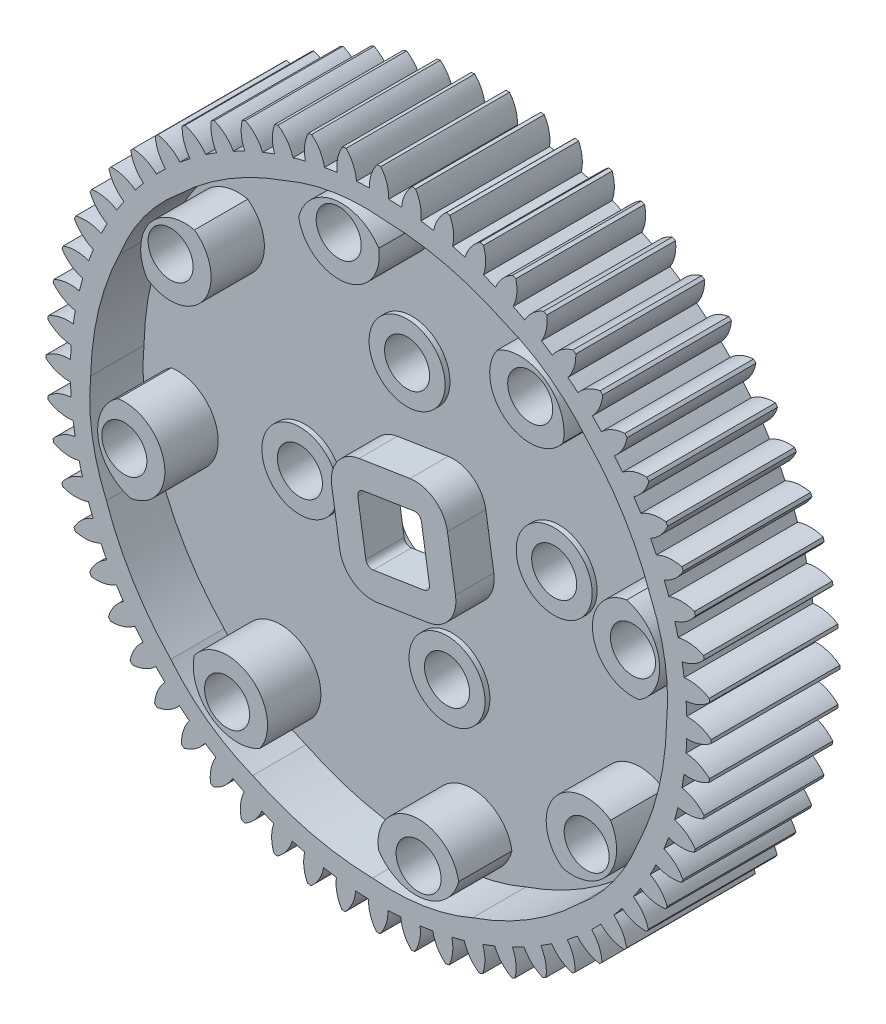
from build123d import *

# Parameters (mm, degrees)
EXTRUSION1_DEPTH = 12.7
EXTRUSION2_START = -5.2578
SKETCH2_R        = 3.75
EXTRUSION2_DEPTH = 2.1844
EXTRUSION3_DEPTH = 12.7
SKETCH4_R        = 2.2225
EXTRUSION4_DEPTH = 12.7
EXTRUSION5_START = -7.9248
SKETCH5_R        = 3.75
EXTRUSION5_DEPTH = 3.1496
EXTRUSION6_START = -7.9248
SKETCH6_R        = 2.2225
EXTRUSION6_DEPTH = 3.1496
EXTRUSION7_START = 3.78000006
EXTRUSION7_DEPTH = 3.78000006
EXTRUSION8_DEPTH = 5.2578


with BuildPart() as part:
    # Sketch1 → Extrusion1 (new body)
    with BuildSketch(Plane.XY):
        with BuildLine():
            ThreePointArc((-14.338556369, 26.825922305), (-15.129020546, 27.835404584), (-16.215598781, 28.516018884))
            ThreePointArc((-16.215598781, 28.516018884), (-16.364685345, 28.430723705), (-16.513323263, 28.344649083))
            ThreePointArc((-16.513323263, 28.344649083), (-16.470552427, 27.063220683), (-15.994676102, 25.872662071))
            ThreePointArc((-15.994676102, 25.872662071), (-16.533004358, 25.532020546), (-17.064080691, 25.180179833))
            ThreePointArc((-17.064080691, 25.180179833), (-17.955734254, 26.101506057), (-19.107503667, 26.664813527))
            ThreePointArc((-19.107503667, 26.664813527), (-19.246857745, 26.564401814), (-19.385684161, 26.463261825))
            ThreePointArc((-19.385684161, 26.463261825), (-19.209201887, 25.193323995), (-18.6114852, 24.059030008))
            ThreePointArc((-18.6114852, 24.059030008), (-19.111257702, 23.663983927), (-19.602647375, 23.258558041))
            ThreePointArc((-19.602647375, 23.258558041), (-20.58572118, 24.081633967), (-21.790062744, 24.521462893))
            ThreePointArc((-21.790062744, 24.521462893), (-21.918157544, 24.407034779), (-22.045651446, 24.291937533))
            ThreePointArc((-22.045651446, 24.291937533), (-21.737391311, 23.047403976), (-21.024382971, 21.981802177))
            ThreePointArc((-21.024382971, 21.981802177), (-21.480124107, 21.536679749), (-21.926443351, 21.082110621))
            ThreePointArc((-21.926443351, 21.082110621), (-22.990166637, 21.797918456), (-24.233885333, 22.109449981))
            ThreePointArc((-24.233885333, 22.109449981), (-24.349317422, 21.982259163), (-24.464081961, 21.85446569))
            ThreePointArc((-24.464081961, 21.85446569), (-24.027421327, 20.648971776), (-23.206933202, 19.663737122))
            ThreePointArc((-23.206933202, 19.663737122), (-23.613649778, 19.1734152), (-24.010008626, 18.674683184))
            ThreePointArc((-24.010008626, 18.674683184), (-25.142727017, 19.275380389), (-26.412196404, 19.455201308))
            ThreePointArc((-26.412196404, 19.455201308), (-26.513701083, 19.316641315), (-26.614478875, 19.177551748))
            ThreePointArc((-26.614478875, 19.177551748), (-26.054201886, 18.024305121), (-25.135223418, 17.130232047))
            ThreePointArc((-25.135223418, 17.130232047), (-25.48845936, 16.600082702), (-25.830515222, 16.062652011))
            ThreePointArc((-25.830515222, 16.062652011), (-27.019818419, 16.541657221), (-28.301129924, 16.587797378))
            ThreePointArc((-28.301129924, 16.587797378), (-28.387595086, 16.439386303), (-28.473281988, 16.290524535))
            ThreePointArc((-28.473281988, 16.290524535), (-27.795527158, 15.202160407), (-26.788126865, 14.409044566))
            ThreePointArc((-26.788126865, 14.409044566), (-27.084012048, 13.844876224), (-27.368017287, 13.274635061))
            ThreePointArc((-27.368017287, 13.274635061), (-28.600875036, 13.626700195), (-29.879990342, 13.538654068))
            ThreePointArc((-29.879990342, 13.538654068), (-29.950468657, 13.382017935), (-30.020125866, 13.225014927))
            ThreePointArc((-30.020125866, 13.225014927), (-29.232318818, 12.213457642), (-28.147533989, 11.529988577))
            ThreePointArc((-28.147533989, 11.529988577), (-28.382826632, 10.937982385), (-28.605669628, 10.341178432))
            ThreePointArc((-28.605669628, 10.341178432), (-29.868574481, 10.56244619), (-31.131479333, 10.341178432))
            ThreePointArc((-31.131479333, 10.341178432), (-31.185198626, 10.178033378), (-31.238062962, 10.014609288))
            ThreePointArc((-31.238062962, 10.014609288), (-30.348835075, 9.090941679), (-29.19855084, 8.524607621))
            ThreePointArc((-29.19855084, 8.524607621), (-29.370673027, 7.911249722), (-29.529912267, 7.294421687))
            ThreePointArc((-29.529912267, 7.294421687), (-30.809027573, 7.382467814), (-32.041885322, 7.03040268))
            ThreePointArc((-32.041885322, 7.03040268), (-32.078257034, 6.862536157), (-32.113749304, 6.694481493))
            ThreePointArc((-32.113749304, 6.694481493), (-31.132843144, 5.868823457), (-29.929662258, 5.425829279))
            ThreePointArc((-29.929662258, 5.425829279), (-30.036728183, 4.797839751), (-30.130619007, 4.167745732))
            ThreePointArc((-30.130619007, 4.167745732), (-31.411930512, 4.121605576), (-32.60123371, 3.642600366))
            ThreePointArc((-32.60123371, 3.642600366), (-32.619859344, 3.471851554), (-32.637590688, 3.301007559))
            ThreePointArc((-32.637590688, 3.301007559), (-31.575753269, 2.582405177), (-30.332858033, 2.267604417))
            ThreePointArc((-30.332858033, 2.267604417), (-30.37369466, 1.631863645), (-30.40120838, 0.995407083))
            ThreePointArc((-30.40120838, 0.995407083), (-31.670677767, 0.815586165), (-32.803396159, 0.21488896))
            ThreePointArc((-32.803396159, 0.21488896), (-32.804071649, 0.043128618), (-32.803847798, -0.128632906))
            ThreePointArc((-32.803847798, -0.128632906), (-31.672712834, -0.732306475), (-30.403720668, -0.915464794))
            ThreePointArc((-30.403720668, -0.915464794), (-30.377880582, -1.551991502), (-30.338715753, -2.187837455))
            ThreePointArc((-30.338715753, -2.187837455), (-31.582434449, -2.499368979), (-32.646157735, -3.215176815))
            ThreePointArc((-32.646157735, -3.215176815), (-32.62887568, -3.386066843), (-32.610699088, -3.556864041))
            ThreePointArc((-32.610699088, -3.556864041), (-31.422659528, -4.038994823), (-30.141473777, -4.088503981))
            ThreePointArc((-30.141473777, -4.088503981), (-30.049240087, -4.718842704), (-29.943825806, -5.347111587))
            ThreePointArc((-29.943825806, -5.347111587), (-31.14816737, -5.786940514), (-32.131241176, -6.610016439))
            ThreePointArc((-32.131241176, -6.610016439), (-32.096190921, -6.778163848), (-32.060260734, -6.946125429))
            ThreePointArc((-32.060260734, -6.946125429), (-30.82833299, -7.301431099), (-29.548990592, -7.216748663))
            ThreePointArc((-29.548990592, -7.216748663), (-29.391373829, -7.833993279), (-29.220865038, -8.447801646))
            ThreePointArc((-29.220865038, -8.447801646), (-30.372634451, -9.011109117), (-31.264288014, -9.932435341))
            ThreePointArc((-31.264288014, -9.932435341), (-31.211853579, -10.095997871), (-31.158563454, -10.259283614))
            ThreePointArc((-31.158563454, -10.259283614), (-29.896244784, -10.483871368), (-28.632762482, -10.265925136))
            ThreePointArc((-28.632762482, -10.265925136), (-28.411489529, -10.863312984), (-28.177754358, -11.455935823))
            ThreePointArc((-28.177754358, -11.455935823), (-29.264332593, -12.136550123), (-30.05479677, -13.146032402))
            ThreePointArc((-30.05479677, -13.146032402), (-29.985552636, -13.303218028), (-29.915486433, -13.46003894))
            ThreePointArc((-29.915486433, -13.46003894), (-28.636607063, -13.551448149), (-27.402827835, -13.202625986))
            ThreePointArc((-27.402827835, -13.202625986), (-27.120323005, -13.773611958), (-26.825922305, -14.338556369))
            ThreePointArc((-26.825922305, -14.338556369), (-27.835404584, -15.129020546), (-28.516018884, -16.215598781))
            ThreePointArc((-28.516018884, -16.215598781), (-28.430723705, -16.364685345), (-28.344649083, -16.513323263))
            ThreePointArc((-28.344649083, -16.513323263), (-27.063220683, -16.470552427), (-25.872662071, -15.994676102))
            ThreePointArc((-25.872662071, -15.994676102), (-25.532020546, -16.533004358), (-25.180179833, -17.064080691))
            ThreePointArc((-25.180179833, -17.064080691), (-26.101506057, -17.955734254), (-26.664813527, -19.107503667))
            ThreePointArc((-26.664813527, -19.107503667), (-26.564401814, -19.246857745), (-26.463261825, -19.385684161))
            ThreePointArc((-26.463261825, -19.385684161), (-25.193323995, -19.209201887), (-24.059030008, -18.6114852))
            ThreePointArc((-24.059030008, -18.6114852), (-23.663983927, -19.111257702), (-23.258558041, -19.602647375))
            ThreePointArc((-23.258558041, -19.602647375), (-24.081633967, -20.58572118), (-24.521462893, -21.790062744))
            ThreePointArc((-24.521462893, -21.790062744), (-24.407034779, -21.918157544), (-24.291937533, -22.045651446))
            ThreePointArc((-24.291937533, -22.045651446), (-23.047403976, -21.737391311), (-21.981802177, -21.024382971))
            ThreePointArc((-21.981802177, -21.024382971), (-21.536679749, -21.480124107), (-21.082110621, -21.926443351))
            ThreePointArc((-21.082110621, -21.926443351), (-21.797918456, -22.990166637), (-22.109449981, -24.233885333))
            ThreePointArc((-22.109449981, -24.233885333), (-21.982259163, -24.349317422), (-21.85446569, -24.464081961))
            ThreePointArc((-21.85446569, -24.464081961), (-20.648971776, -24.027421327), (-19.663737122, -23.206933202))
            ThreePointArc((-19.663737122, -23.206933202), (-19.1734152, -23.613649778), (-18.674683184, -24.010008626))
            ThreePointArc((-18.674683184, -24.010008626), (-19.275380389, -25.142727017), (-19.455201308, -26.412196404))
            ThreePointArc((-19.455201308, -26.412196404), (-19.316641315, -26.513701083), (-19.177551748, -26.614478875))
            ThreePointArc((-19.177551748, -26.614478875), (-18.024305121, -26.054201886), (-17.130232047, -25.135223418))
            ThreePointArc((-17.130232047, -25.135223418), (-16.600082702, -25.48845936), (-16.062652011, -25.830515222))
            ThreePointArc((-16.062652011, -25.830515222), (-16.541657221, -27.019818419), (-16.587797378, -28.301129924))
            ThreePointArc((-16.587797378, -28.301129924), (-16.439386303, -28.387595086), (-16.290524535, -28.473281988))
            ThreePointArc((-16.290524535, -28.473281988), (-15.202160407, -27.795527158), (-14.409044566, -26.788126865))
            ThreePointArc((-14.409044566, -26.788126865), (-13.844876224, -27.084012048), (-13.274635061, -27.368017287))
            ThreePointArc((-13.274635061, -27.368017287), (-13.626700195, -28.600875036), (-13.538654068, -29.879990342))
            ThreePointArc((-13.538654068, -29.879990342), (-13.382017935, -29.950468657), (-13.225014927, -30.020125866))
            ThreePointArc((-13.225014927, -30.020125866), (-12.213457642, -29.232318818), (-11.529988577, -28.147533989))
            ThreePointArc((-11.529988577, -28.147533989), (-10.937982385, -28.382826632), (-10.341178432, -28.605669628))
            ThreePointArc((-10.341178432, -28.605669628), (-10.56244619, -29.868574481), (-10.341178432, -31.131479333))
            ThreePointArc((-10.341178432, -31.131479333), (-10.178033378, -31.185198626), (-10.014609288, -31.238062962))
            ThreePointArc((-10.014609288, -31.238062962), (-9.090941679, -30.348835075), (-8.524607621, -29.19855084))
            ThreePointArc((-8.524607621, -29.19855084), (-7.911249722, -29.370673027), (-7.294421687, -29.529912267))
            ThreePointArc((-7.294421687, -29.529912267), (-7.382467814, -30.809027573), (-7.03040268, -32.041885322))
            ThreePointArc((-7.03040268, -32.041885322), (-6.862536157, -32.078257034), (-6.694481493, -32.113749304))
            ThreePointArc((-6.694481493, -32.113749304), (-5.868823457, -31.132843144), (-5.425829279, -29.929662258))
            ThreePointArc((-5.425829279, -29.929662258), (-4.797839751, -30.036728183), (-4.167745732, -30.130619007))
            ThreePointArc((-4.167745732, -30.130619007), (-4.121605576, -31.411930512), (-3.642600366, -32.60123371))
            ThreePointArc((-3.642600366, -32.60123371), (-3.471851554, -32.619859344), (-3.301007559, -32.637590688))
            ThreePointArc((-3.301007559, -32.637590688), (-2.582405177, -31.575753269), (-2.267604417, -30.332858033))
            ThreePointArc((-2.267604417, -30.332858033), (-1.631863645, -30.37369466), (-0.995407083, -30.40120838))
            ThreePointArc((-0.995407083, -30.40120838), (-0.815586165, -31.670677767), (-0.21488896, -32.803396159))
            ThreePointArc((-0.21488896, -32.803396159), (-0.043128618, -32.804071649), (0.128632906, -32.803847798))
            ThreePointArc((0.128632906, -32.803847798), (0.732306475, -31.672712834), (0.915464794, -30.403720668))
            ThreePointArc((0.915464794, -30.403720668), (1.551991502, -30.377880582), (2.187837455, -30.338715753))
            ThreePointArc((2.187837455, -30.338715753), (2.499368979, -31.582434449), (3.215176815, -32.646157735))
            ThreePointArc((3.215176815, -32.646157735), (3.386066843, -32.62887568), (3.556864041, -32.610699088))
            ThreePointArc((3.556864041, -32.610699088), (4.038994823, -31.422659528), (4.088503981, -30.141473777))
            ThreePointArc((4.088503981, -30.141473777), (4.718842704, -30.049240087), (5.347111587, -29.943825806))
            ThreePointArc((5.347111587, -29.943825806), (5.786940514, -31.14816737), (6.610016439, -32.131241176))
            ThreePointArc((6.610016439, -32.131241176), (6.778163848, -32.096190921), (6.946125429, -32.060260734))
            ThreePointArc((6.946125429, -32.060260734), (7.301431099, -30.82833299), (7.216748663, -29.548990592))
            ThreePointArc((7.216748663, -29.548990592), (7.833993279, -29.391373829), (8.447801646, -29.220865038))
            ThreePointArc((8.447801646, -29.220865038), (9.011109117, -30.372634451), (9.932435341, -31.264288014))
            ThreePointArc((9.932435341, -31.264288014), (10.095997871, -31.211853579), (10.259283614, -31.158563454))
            ThreePointArc((10.259283614, -31.158563454), (10.483871368, -29.896244784), (10.265925136, -28.632762482))
            ThreePointArc((10.265925136, -28.632762482), (10.863312984, -28.411489529), (11.455935823, -28.177754358))
            ThreePointArc((11.455935823, -28.177754358), (12.136550123, -29.264332593), (13.146032402, -30.05479677))
            ThreePointArc((13.146032402, -30.05479677), (13.303218028, -29.985552636), (13.46003894, -29.915486433))
            ThreePointArc((13.46003894, -29.915486433), (13.551448149, -28.636607063), (13.202625986, -27.402827835))
            ThreePointArc((13.202625986, -27.402827835), (13.773611958, -27.120323005), (14.338556369, -26.825922305))
            ThreePointArc((14.338556369, -26.825922305), (15.129020546, -27.835404584), (16.215598781, -28.516018884))
            ThreePointArc((16.215598781, -28.516018884), (16.364685345, -28.430723705), (16.513323263, -28.344649083))
            ThreePointArc((16.513323263, -28.344649083), (16.470552427, -27.063220683), (15.994676102, -25.872662071))
            ThreePointArc((15.994676102, -25.872662071), (16.533004358, -25.532020546), (17.064080691, -25.180179833))
            ThreePointArc((17.064080691, -25.180179833), (17.955734254, -26.101506057), (19.107503667, -26.664813527))
            ThreePointArc((19.107503667, -26.664813527), (19.246857745, -26.564401814), (19.385684161, -26.463261825))
            ThreePointArc((19.385684161, -26.463261825), (19.209201887, -25.193323995), (18.6114852, -24.059030008))
            ThreePointArc((18.6114852, -24.059030008), (19.111257702, -23.663983927), (19.602647375, -23.258558041))
            ThreePointArc((19.602647375, -23.258558041), (20.58572118, -24.081633967), (21.790062744, -24.521462893))
            ThreePointArc((21.790062744, -24.521462893), (21.918157544, -24.407034779), (22.045651446, -24.291937533))
            ThreePointArc((22.045651446, -24.291937533), (21.737391311, -23.047403976), (21.024382971, -21.981802177))
            ThreePointArc((21.024382971, -21.981802177), (21.480124107, -21.536679749), (21.926443351, -21.082110621))
            ThreePointArc((21.926443351, -21.082110621), (22.990166637, -21.797918456), (24.233885333, -22.109449981))
            ThreePointArc((24.233885333, -22.109449981), (24.349317422, -21.982259163), (24.464081961, -21.85446569))
            ThreePointArc((24.464081961, -21.85446569), (24.027421327, -20.648971776), (23.206933202, -19.663737122))
            ThreePointArc((23.206933202, -19.663737122), (23.613649778, -19.1734152), (24.010008626, -18.674683184))
            ThreePointArc((24.010008626, -18.674683184), (25.142727017, -19.275380389), (26.412196404, -19.455201308))
            ThreePointArc((26.412196404, -19.455201308), (26.513701083, -19.316641315), (26.614478875, -19.177551748))
            ThreePointArc((26.614478875, -19.177551748), (26.054201886, -18.024305121), (25.135223418, -17.130232047))
            ThreePointArc((25.135223418, -17.130232047), (25.48845936, -16.600082702), (25.830515222, -16.062652011))
            ThreePointArc((25.830515222, -16.062652011), (27.019818419, -16.541657221), (28.301129924, -16.587797378))
            ThreePointArc((28.301129924, -16.587797378), (28.387595086, -16.439386303), (28.473281988, -16.290524535))
            ThreePointArc((28.473281988, -16.290524535), (27.795527158, -15.202160407), (26.788126865, -14.409044566))
            ThreePointArc((26.788126865, -14.409044566), (27.084012048, -13.844876224), (27.368017287, -13.274635061))
            ThreePointArc((27.368017287, -13.274635061), (28.600875036, -13.626700195), (29.879990342, -13.538654068))
            ThreePointArc((29.879990342, -13.538654068), (29.950468657, -13.382017935), (30.020125866, -13.225014927))
            ThreePointArc((30.020125866, -13.225014927), (29.232318818, -12.213457642), (28.147533989, -11.529988577))
            ThreePointArc((28.147533989, -11.529988577), (28.382826632, -10.937982385), (28.605669628, -10.341178432))
            ThreePointArc((28.605669628, -10.341178432), (29.868574481, -10.56244619), (31.131479333, -10.341178432))
            ThreePointArc((31.131479333, -10.341178432), (31.185198626, -10.178033378), (31.238062962, -10.014609288))
            ThreePointArc((31.238062962, -10.014609288), (30.348835075, -9.090941679), (29.19855084, -8.524607621))
            ThreePointArc((29.19855084, -8.524607621), (29.370673027, -7.911249722), (29.529912267, -7.294421687))
            ThreePointArc((29.529912267, -7.294421687), (30.809027573, -7.382467814), (32.041885322, -7.03040268))
            ThreePointArc((32.041885322, -7.03040268), (32.078257033, -6.862536157), (32.113749304, -6.694481493))
            ThreePointArc((32.113749304, -6.694481493), (31.132843144, -5.868823457), (29.929662258, -5.425829279))
            ThreePointArc((29.929662258, -5.425829279), (30.036728183, -4.797839751), (30.130619007, -4.167745732))
            ThreePointArc((30.130619007, -4.167745732), (31.411930512, -4.121605576), (32.60123371, -3.642600366))
            ThreePointArc((32.60123371, -3.642600366), (32.619859344, -3.471851554), (32.637590688, -3.301007559))
            ThreePointArc((32.637590688, -3.301007559), (31.575753269, -2.582405177), (30.332858033, -2.267604417))
            ThreePointArc((30.332858033, -2.267604417), (30.37369466, -1.631863645), (30.40120838, -0.995407083))
            ThreePointArc((30.40120838, -0.995407083), (31.670677767, -0.815586165), (32.803396159, -0.21488896))
            ThreePointArc((32.803396159, -0.21488896), (32.804071649, -0.043128618), (32.803847798, 0.128632906))
            ThreePointArc((32.803847798, 0.128632906), (31.672712834, 0.732306475), (30.403720668, 0.915464794))
            ThreePointArc((30.403720668, 0.915464794), (30.377880582, 1.551991502), (30.338715753, 2.187837455))
            ThreePointArc((30.338715753, 2.187837455), (31.582434449, 2.499368979), (32.646157735, 3.215176815))
            ThreePointArc((32.646157735, 3.215176815), (32.62887568, 3.386066843), (32.610699088, 3.556864041))
            ThreePointArc((32.610699088, 3.556864041), (31.422659528, 4.038994823), (30.141473777, 4.088503981))
            ThreePointArc((30.141473777, 4.088503981), (30.049240087, 4.718842704), (29.943825806, 5.347111587))
            ThreePointArc((29.943825806, 5.347111587), (31.14816737, 5.786940514), (32.131241176, 6.610016439))
            ThreePointArc((32.131241176, 6.610016439), (32.096190921, 6.778163848), (32.060260734, 6.946125429))
            ThreePointArc((32.060260734, 6.946125429), (30.82833299, 7.301431099), (29.548990592, 7.216748663))
            ThreePointArc((29.548990592, 7.216748663), (29.391373829, 7.833993279), (29.220865038, 8.447801646))
            ThreePointArc((29.220865038, 8.447801646), (30.372634451, 9.011109117), (31.264288014, 9.932435341))
            ThreePointArc((31.264288014, 9.932435341), (31.211853579, 10.095997871), (31.158563454, 10.259283614))
            ThreePointArc((31.158563454, 10.259283614), (29.896244784, 10.483871368), (28.632762482, 10.265925136))
            ThreePointArc((28.632762482, 10.265925136), (28.411489529, 10.863312984), (28.177754358, 11.455935823))
            ThreePointArc((28.177754358, 11.455935823), (29.264332593, 12.136550123), (30.05479677, 13.146032402))
            ThreePointArc((30.05479677, 13.146032402), (29.985552636, 13.303218028), (29.915486433, 13.46003894))
            ThreePointArc((29.915486433, 13.46003894), (28.636607063, 13.551448149), (27.402827835, 13.202625986))
            ThreePointArc((27.402827835, 13.202625986), (27.120323005, 13.773611958), (26.825922305, 14.338556369))
            ThreePointArc((26.825922305, 14.338556369), (27.835404584, 15.129020546), (28.516018884, 16.215598781))
            ThreePointArc((28.516018884, 16.215598781), (28.430723705, 16.364685345), (28.344649083, 16.513323263))
            ThreePointArc((28.344649083, 16.513323263), (27.063220683, 16.470552427), (25.872662071, 15.994676102))
            ThreePointArc((25.872662071, 15.994676102), (25.532020546, 16.533004358), (25.180179833, 17.064080691))
            ThreePointArc((25.180179833, 17.064080691), (26.101506057, 17.955734254), (26.664813527, 19.107503667))
            ThreePointArc((26.664813527, 19.107503667), (26.564401814, 19.246857745), (26.463261825, 19.385684161))
            ThreePointArc((26.463261825, 19.385684161), (25.193323995, 19.209201887), (24.059030008, 18.6114852))
            ThreePointArc((24.059030008, 18.6114852), (23.663983927, 19.111257702), (23.258558041, 19.602647375))
            ThreePointArc((23.258558041, 19.602647375), (24.081633967, 20.58572118), (24.521462893, 21.790062744))
            ThreePointArc((24.521462893, 21.790062744), (24.407034779, 21.918157544), (24.291937533, 22.045651446))
            ThreePointArc((24.291937533, 22.045651446), (23.047403976, 21.737391311), (21.981802177, 21.024382971))
            ThreePointArc((21.981802177, 21.024382971), (21.536679749, 21.480124107), (21.082110621, 21.926443351))
            ThreePointArc((21.082110621, 21.926443351), (21.797918456, 22.990166637), (22.109449981, 24.233885333))
            ThreePointArc((22.109449981, 24.233885333), (21.982259163, 24.349317422), (21.85446569, 24.464081961))
            ThreePointArc((21.85446569, 24.464081961), (20.648971776, 24.027421327), (19.663737122, 23.206933202))
            ThreePointArc((19.663737122, 23.206933202), (19.1734152, 23.613649778), (18.674683184, 24.010008626))
            ThreePointArc((18.674683184, 24.010008626), (19.275380389, 25.142727017), (19.455201308, 26.412196404))
            ThreePointArc((19.455201308, 26.412196404), (19.316641315, 26.513701083), (19.177551748, 26.614478875))
            ThreePointArc((19.177551748, 26.614478875), (18.024305121, 26.054201886), (17.130232047, 25.135223418))
            ThreePointArc((17.130232047, 25.135223418), (16.600082702, 25.48845936), (16.062652011, 25.830515222))
            ThreePointArc((16.062652011, 25.830515222), (16.541657221, 27.019818419), (16.587797378, 28.301129924))
            ThreePointArc((16.587797378, 28.301129924), (16.439386303, 28.387595086), (16.290524535, 28.473281988))
            ThreePointArc((16.290524535, 28.473281988), (15.202160407, 27.795527158), (14.409044566, 26.788126865))
            ThreePointArc((14.409044566, 26.788126865), (13.844876224, 27.084012048), (13.274635061, 27.368017287))
            ThreePointArc((13.274635061, 27.368017287), (13.626700195, 28.600875036), (13.538654068, 29.879990342))
            ThreePointArc((13.538654068, 29.879990342), (13.382017935, 29.950468657), (13.225014927, 30.020125866))
            ThreePointArc((13.225014927, 30.020125866), (12.213457642, 29.232318818), (11.529988577, 28.147533989))
            ThreePointArc((11.529988577, 28.147533989), (10.937982385, 28.382826632), (10.341178432, 28.605669628))
            ThreePointArc((10.341178432, 28.605669628), (10.56244619, 29.868574481), (10.341178432, 31.131479333))
            ThreePointArc((10.341178432, 31.131479333), (10.178033378, 31.185198626), (10.014609288, 31.238062962))
            ThreePointArc((10.014609288, 31.238062962), (9.090941679, 30.348835075), (8.524607621, 29.19855084))
            ThreePointArc((8.524607621, 29.19855084), (7.911249722, 29.370673027), (7.294421687, 29.529912267))
            ThreePointArc((7.294421687, 29.529912267), (7.382467814, 30.809027573), (7.03040268, 32.041885322))
            ThreePointArc((7.03040268, 32.041885322), (6.862536157, 32.078257033), (6.694481493, 32.113749304))
            ThreePointArc((6.694481493, 32.113749304), (5.868823457, 31.132843144), (5.425829279, 29.929662258))
            ThreePointArc((5.425829279, 29.929662258), (4.797839751, 30.036728183), (4.167745732, 30.130619007))
            ThreePointArc((4.167745732, 30.130619007), (4.121605576, 31.411930512), (3.642600366, 32.60123371))
            ThreePointArc((3.642600366, 32.60123371), (3.471851554, 32.619859344), (3.301007559, 32.637590688))
            ThreePointArc((3.301007559, 32.637590688), (2.582405177, 31.575753269), (2.267604417, 30.332858033))
            ThreePointArc((2.267604417, 30.332858033), (1.631863645, 30.37369466), (0.995407083, 30.40120838))
            ThreePointArc((0.995407083, 30.40120838), (0.815586165, 31.670677767), (0.21488896, 32.803396159))
            ThreePointArc((0.21488896, 32.803396159), (0.043128618, 32.804071649), (-0.128632906, 32.803847798))
            ThreePointArc((-0.128632906, 32.803847798), (-0.732306475, 31.672712834), (-0.915464794, 30.403720668))
            ThreePointArc((-0.915464794, 30.403720668), (-1.551991502, 30.377880582), (-2.187837455, 30.338715753))
            ThreePointArc((-2.187837455, 30.338715753), (-2.499368979, 31.582434449), (-3.215176815, 32.646157735))
            ThreePointArc((-3.215176815, 32.646157735), (-3.386066843, 32.62887568), (-3.556864041, 32.610699088))
            ThreePointArc((-3.556864041, 32.610699088), (-4.038994823, 31.422659528), (-4.088503981, 30.141473777))
            ThreePointArc((-4.088503981, 30.141473777), (-4.718842704, 30.049240087), (-5.347111587, 29.943825806))
            ThreePointArc((-5.347111587, 29.943825806), (-5.786940514, 31.14816737), (-6.610016439, 32.131241176))
            ThreePointArc((-6.610016439, 32.131241176), (-6.778163848, 32.096190921), (-6.946125429, 32.060260734))
            ThreePointArc((-6.946125429, 32.060260734), (-7.301431099, 30.82833299), (-7.216748663, 29.548990592))
            ThreePointArc((-7.216748663, 29.548990592), (-7.833993279, 29.391373829), (-8.447801646, 29.220865038))
            ThreePointArc((-8.447801646, 29.220865038), (-9.011109117, 30.372634451), (-9.932435341, 31.264288014))
            ThreePointArc((-9.932435341, 31.264288014), (-10.095997871, 31.211853579), (-10.259283614, 31.158563454))
            ThreePointArc((-10.259283614, 31.158563454), (-10.483871368, 29.896244784), (-10.265925136, 28.632762482))
            ThreePointArc((-10.265925136, 28.632762482), (-10.863312984, 28.411489529), (-11.455935823, 28.177754358))
            ThreePointArc((-11.455935823, 28.177754358), (-12.136550123, 29.264332593), (-13.146032402, 30.05479677))
            ThreePointArc((-13.146032402, 30.05479677), (-13.303218028, 29.985552636), (-13.46003894, 29.915486433))
            ThreePointArc((-13.46003894, 29.915486433), (-13.551448149, 28.636607063), (-13.202625986, 27.402827835))
            ThreePointArc((-13.202625986, 27.402827835), (-13.773611958, 27.120323005), (-14.338556369, 26.825922305))
        make_face()
        with BuildLine():
            ThreePointArc((-9.279260902, 26.859814284), (-14.816234287, 24.249402215), (-19.665701273, 20.513763664))
            ThreePointArc((-19.665701273, 20.513763664), (-23.129908784, 16.851368666), (-25.554185132, 12.431328509))
            ThreePointArc((-25.554185132, 12.431328509), (-27.623576483, 6.670257005), (-28.411172122, 0.599670662))
            ThreePointArc((-28.411172122, 0.599670662), (-28.271032405, -4.439598293), (-26.859814284, -9.279260902))
            ThreePointArc((-26.859814284, -9.279260902), (-24.249402215, -14.816234287), (-20.513763664, -19.665701273))
            ThreePointArc((-20.513763664, -19.665701273), (-16.851368666, -23.129908784), (-12.431328509, -25.554185132))
            ThreePointArc((-12.431328509, -25.554185132), (-6.670257005, -27.623576483), (-0.599670662, -28.411172122))
            ThreePointArc((-0.599670662, -28.411172122), (4.439598293, -28.271032405), (9.279260902, -26.859814284))
            ThreePointArc((9.279260902, -26.859814284), (14.816234287, -24.249402215), (19.665701273, -20.513763664))
            ThreePointArc((19.665701273, -20.513763664), (23.129908784, -16.851368666), (25.554185132, -12.431328509))
            ThreePointArc((25.554185132, -12.431328509), (27.623576483, -6.670257005), (28.411172122, -0.599670662))
            ThreePointArc((28.411172122, -0.599670662), (28.271032405, 4.439598293), (26.859814284, 9.279260902))
            ThreePointArc((26.859814284, 9.279260902), (24.249402215, 14.816234287), (20.513763664, 19.665701273))
            ThreePointArc((20.513763664, 19.665701273), (16.851368666, 23.129908784), (12.431328509, 25.554185132))
            ThreePointArc((12.431328509, 25.554185132), (6.670257005, 27.623576483), (0.599670662, 28.411172122))
            ThreePointArc((0.599670662, 28.411172122), (-4.439598293, 28.271032405), (-9.279260902, 26.859814284))
        make_face(mode=Mode.SUBTRACT)
    extrude(amount=-EXTRUSION1_DEPTH)

    # Sketch2 → Extrusion2 (add)
    with BuildSketch(Plane.XY.offset(EXTRUSION2_START)):
        with BuildLine():
            ThreePointArc((-9.279260902, 26.859814284), (-14.816234287, 24.249402215), (-19.665701273, 20.513763664))
            ThreePointArc((-19.665701273, 20.513763664), (-23.129908784, 16.851368666), (-25.554185132, 12.431328509))
            ThreePointArc((-25.554185132, 12.431328509), (-27.623576483, 6.670257005), (-28.411172122, 0.599670662))
            ThreePointArc((-28.411172122, 0.599670662), (-28.271032405, -4.439598293), (-26.859814284, -9.279260902))
            ThreePointArc((-26.859814284, -9.279260902), (-24.249402215, -14.816234287), (-20.513763664, -19.665701273))
            ThreePointArc((-20.513763664, -19.665701273), (-16.851368666, -23.129908784), (-12.431328509, -25.554185132))
            ThreePointArc((-12.431328509, -25.554185132), (-6.670257005, -27.623576483), (-0.599670662, -28.411172122))
            ThreePointArc((-0.599670662, -28.411172122), (4.439598293, -28.271032405), (9.279260902, -26.859814284))
            ThreePointArc((9.279260902, -26.859814284), (14.816234287, -24.249402215), (19.665701273, -20.513763664))
            ThreePointArc((19.665701273, -20.513763664), (23.129908784, -16.851368666), (25.554185132, -12.431328509))
            ThreePointArc((25.554185132, -12.431328509), (27.623576483, -6.670257005), (28.411172122, -0.599670662))
            ThreePointArc((28.411172122, -0.599670662), (28.271032405, 4.439598293), (26.859814284, 9.279260902))
            ThreePointArc((26.859814284, 9.279260902), (24.249402215, 14.816234287), (20.513763664, 19.665701273))
            ThreePointArc((20.513763664, 19.665701273), (16.851368666, 23.129908784), (12.431328509, 25.554185132))
            ThreePointArc((12.431328509, 25.554185132), (6.670257005, 27.623576483), (0.599670662, 28.411172122))
            ThreePointArc((0.599670662, 28.411172122), (-4.439598293, 28.271032405), (-9.279260902, 26.859814284))
        make_face()
        with Locations((-1.970224455, 12.546243087)):
            Circle(SKETCH2_R, mode=Mode.SUBTRACT)
        with Locations((-12.546243087, -1.970224455)):
            Circle(SKETCH2_R, mode=Mode.SUBTRACT)
        with Locations((12.546243087, 1.970224455)):
            Circle(SKETCH2_R, mode=Mode.SUBTRACT)
        with Locations((1.970224455, -12.546243087)):
            Circle(SKETCH2_R, mode=Mode.SUBTRACT)
        with BuildLine():
            Line((5.315977553, 3.405933448), (6.104067335, -1.612563787))
            ThreePointArc((6.104067335, -1.612563787), (5.522002496, -4.023072495), (3.405933448, -5.315977553))
            Line((3.405933448, -5.315977553), (-1.612563787, -6.104067335))
            ThreePointArc((-1.612563787, -6.104067335), (-4.023072495, -5.522002496), (-5.315977553, -3.405933448))
            Line((-5.315977553, -3.405933448), (-6.104067335, 1.612563787))
            ThreePointArc((-6.104067335, 1.612563787), (-5.522002496, 4.023072495), (-3.405933448, 5.315977553))
            Line((-3.405933448, 5.315977553), (1.612563787, 6.104067335))
            ThreePointArc((1.612563787, 6.104067335), (4.023072495, 5.522002496), (5.315977553, 3.405933448))
        make_face(mode=Mode.SUBTRACT)
        with BuildLine():
            ThreePointArc((-25.713029309, 0.011123717), (-27.678296511, -4.346516823), (-24.471943039, -7.892021535))
            ThreePointArc((-24.471943039, -7.892021535), (-21.140913548, -3.319905774), (-25.713029309, 0.011123717))
        make_face(mode=Mode.SUBTRACT)
        with BuildLine():
            ThreePointArc((18.189723045, 18.173991734), (16.498059634, 22.644962675), (11.723774927, 22.884778816))
            ThreePointArc((11.723774927, 22.884778816), (12.601355445, 17.296411216), (18.189723045, 18.173991734))
        make_face(mode=Mode.SUBTRACT)
        with BuildLine():
            ThreePointArc((-0.011123717, -25.713029309), (4.346516823, -27.678296511), (7.892021535, -24.471943039))
            ThreePointArc((7.892021535, -24.471943039), (3.319905774, -21.140913548), (-0.011123717, -25.713029309))
        make_face(mode=Mode.SUBTRACT)
        with BuildLine():
            ThreePointArc((-7.892021535, 24.471943039), (-3.319905774, 21.140913548), (0.011123717, 25.713029309))
            ThreePointArc((0.011123717, 25.713029309), (-4.346516823, 27.678296511), (-7.892021535, 24.471943039))
        make_face(mode=Mode.SUBTRACT)
        with BuildLine():
            ThreePointArc((-11.723774927, -22.884778816), (-12.601355445, -17.296411216), (-18.189723045, -18.173991734))
            ThreePointArc((-18.189723045, -18.173991734), (-16.498059634, -22.644962675), (-11.723774927, -22.884778816))
        make_face(mode=Mode.SUBTRACT)
        with BuildLine():
            ThreePointArc((-18.173991734, 18.189723045), (-22.644962675, 16.498059634), (-22.884778816, 11.723774927))
            ThreePointArc((-22.884778816, 11.723774927), (-17.296411216, 12.601355445), (-18.173991734, 18.189723045))
        make_face(mode=Mode.SUBTRACT)
        with BuildLine():
            ThreePointArc((22.884778816, -11.723774927), (17.296411216, -12.601355445), (18.173991734, -18.189723045))
            ThreePointArc((18.173991734, -18.189723045), (22.644962675, -16.498059634), (22.884778816, -11.723774927))
        make_face(mode=Mode.SUBTRACT)
        with BuildLine():
            ThreePointArc((25.713029309, -0.011123717), (27.678296511, 4.346516823), (24.471943039, 7.892021535))
            ThreePointArc((24.471943039, 7.892021535), (21.140913548, 3.319905774), (25.713029309, -0.011123717))
        make_face(mode=Mode.SUBTRACT)
    extrude(amount=-EXTRUSION2_DEPTH)

    # Sketch3 → Extrusion3 (add)
    with BuildSketch(Plane.XY):
        with BuildLine():
            ThreePointArc((-25.713029309, 0.011123717), (-27.678296511, -4.346516823), (-24.471943039, -7.892021535))
            ThreePointArc((-24.471943039, -7.892021535), (-21.140913548, -3.319905774), (-25.713029309, 0.011123717))
        make_face()
        with BuildLine():
            ThreePointArc((18.189723045, 18.173991734), (16.498059634, 22.644962675), (11.723774927, 22.884778816))
            ThreePointArc((11.723774927, 22.884778816), (12.601355445, 17.296411216), (18.189723045, 18.173991734))
        make_face()
        with BuildLine():
            ThreePointArc((-0.011123717, -25.713029309), (4.346516823, -27.678296511), (7.892021535, -24.471943039))
            ThreePointArc((7.892021535, -24.471943039), (3.319905774, -21.140913548), (-0.011123717, -25.713029309))
        make_face()
        with BuildLine():
            ThreePointArc((-7.892021535, 24.471943039), (-3.319905774, 21.140913548), (0.011123717, 25.713029309))
            ThreePointArc((0.011123717, 25.713029309), (-4.346516823, 27.678296511), (-7.892021535, 24.471943039))
        make_face()
        with BuildLine():
            ThreePointArc((-11.723774927, -22.884778816), (-12.601355445, -17.296411216), (-18.189723045, -18.173991734))
            ThreePointArc((-18.189723045, -18.173991734), (-16.498059634, -22.644962675), (-11.723774927, -22.884778816))
        make_face()
        with BuildLine():
            ThreePointArc((-18.173991734, 18.189723045), (-22.644962675, 16.498059634), (-22.884778816, 11.723774927))
            ThreePointArc((-22.884778816, 11.723774927), (-17.296411216, 12.601355445), (-18.173991734, 18.189723045))
        make_face()
        with BuildLine():
            ThreePointArc((22.884778816, -11.723774927), (17.296411216, -12.601355445), (18.173991734, -18.189723045))
            ThreePointArc((18.173991734, -18.189723045), (22.644962675, -16.498059634), (22.884778816, -11.723774927))
        make_face()
        with BuildLine():
            ThreePointArc((25.713029309, -0.011123717), (27.678296511, 4.346516823), (24.471943039, 7.892021535))
            ThreePointArc((24.471943039, 7.892021535), (21.140913548, 3.319905774), (25.713029309, -0.011123717))
        make_face()
    extrude(amount=-EXTRUSION3_DEPTH)

    # Sketch4 → Extrusion4 (cut)
    with BuildSketch(Plane.XY):
        with Locations((-25.092486174, -3.940448909)):
            Circle(SKETCH4_R)
        with Locations((14.956748986, 20.529385275)):
            Circle(SKETCH4_R)
        with Locations((3.940448909, -25.092486174)):
            Circle(SKETCH4_R)
        with Locations((-3.940448909, 25.092486174)):
            Circle(SKETCH4_R)
        with Locations((-14.956748986, -20.529385275)):
            Circle(SKETCH4_R)
        with Locations((-20.529385275, 14.956748986)):
            Circle(SKETCH4_R)
        with Locations((20.529385275, -14.956748986)):
            Circle(SKETCH4_R)
        with Locations((25.092486174, 3.940448909)):
            Circle(SKETCH4_R)
    extrude(amount=-EXTRUSION4_DEPTH, mode=Mode.SUBTRACT)

    # Sketch5 → Extrusion5 (add)
    with BuildSketch(Plane.XY.offset(EXTRUSION5_START)):
        with Locations(Location((-1.970224455, 12.546243087, 0), (0, 0, 180))):
            Circle(SKETCH5_R)
        with Locations(Location((-12.546243087, -1.970224455, 0), (0, 0, 180))):
            Circle(SKETCH5_R)
        with Locations(Location((12.546243087, 1.970224455, 0), (0, 0, 180))):
            Circle(SKETCH5_R)
        with Locations(Location((1.970224455, -12.546243087, 0), (0, 0, 180))):
            Circle(SKETCH5_R)
    extrude(amount=EXTRUSION5_DEPTH)

    # Sketch6 → Extrusion6 (cut)
    with BuildSketch(Plane.XY.offset(EXTRUSION6_START)):
        with Locations((-1.970224455, 12.546243087)):
            Circle(SKETCH6_R)
        with Locations((-12.546243087, -1.970224455)):
            Circle(SKETCH6_R)
        with Locations((12.546243087, 1.970224455)):
            Circle(SKETCH6_R)
        with Locations((1.970224455, -12.546243087)):
            Circle(SKETCH6_R)
    extrude(amount=EXTRUSION6_DEPTH, mode=Mode.SUBTRACT)


with BuildPart() as body_2:
    # Sketch7 → Extrusion7 (new body)
    with BuildSketch(Plane(origin=(0, 0, -5.2578), x_dir=(0.9720621618166992, -0.2347235684038677, 0), z_dir=(0, 0, 1)).offset(EXTRUSION7_START)):
        with BuildLine():
            Line((-4.558564251, 4.36800778), (0.134743774, 6.312039616))
            ThreePointArc((0.134743774, 6.312039616), (2.614532416, 6.312039616), (4.36800778, 4.558564251))
            Line((4.36800778, 4.558564251), (6.312039616, -0.134743774))
            ThreePointArc((6.312039616, -0.134743774), (6.312039616, -2.614532416), (4.558564251, -4.36800778))
            Line((4.558564251, -4.36800778), (-0.134743774, -6.312039616))
            ThreePointArc((-0.134743774, -6.312039616), (-2.614532416, -6.312039616), (-4.36800778, -4.558564251))
            Line((-4.36800778, -4.558564251), (-6.312039616, 0.134743774))
            ThreePointArc((-6.312039616, 0.134743774), (-6.312039616, 2.614532416), (-4.558564251, 4.36800778))
        make_face()
    extrude(amount=-EXTRUSION7_DEPTH)

    # Sketch8 → Extrusion8 (cut)
    with BuildSketch(Plane.XY):
        with BuildLine():
            Line((-3.530605663, 2.016692504), (-2.742515881, -3.001804731))
            ThreePointArc((-2.742515881, -3.001804731), (-2.489122451, -3.41652814), (-2.016692504, -3.530605663))
            Line((-2.016692504, -3.530605663), (3.001804731, -2.742515881))
            ThreePointArc((3.001804731, -2.742515881), (3.41652814, -2.489122451), (3.530605663, -2.016692504))
            Line((3.530605663, -2.016692504), (2.742515881, 3.001804731))
            ThreePointArc((2.742515881, 3.001804731), (2.489122451, 3.41652814), (2.016692504, 3.530605663))
            Line((2.016692504, 3.530605663), (-3.001804731, 2.742515881))
            ThreePointArc((-3.001804731, 2.742515881), (-3.41652814, 2.489122451), (-3.530605663, 2.016692504))
        make_face()
    extrude(amount=-EXTRUSION8_DEPTH, mode=Mode.SUBTRACT)


solid = Compound([part.part, body_2.part])
